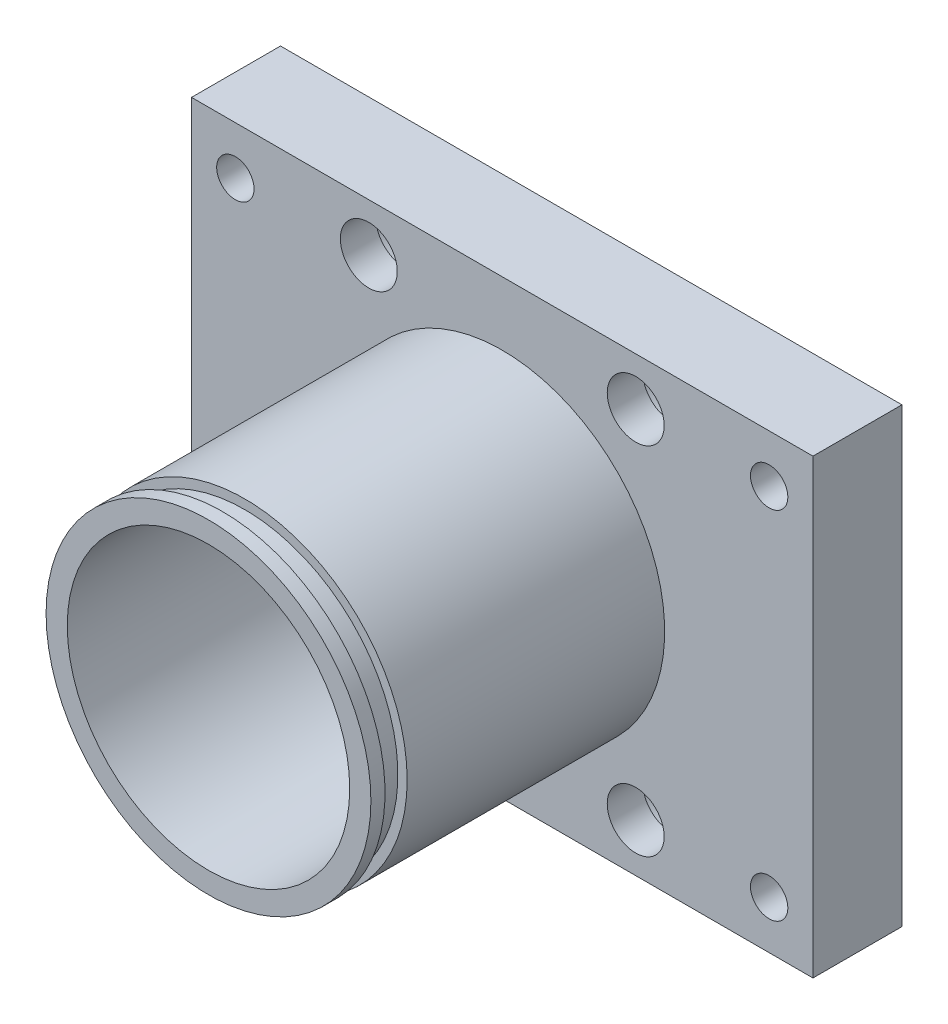
from build123d import *

# Parameters (mm, degrees)
SKETCH1_W                      = 69.85
SKETCH1_H                      = 50.8
BOSS_EXTRUDE1_DEPTH            = 10
SKETCH2_R                      = 15.875
CUT_EXTRUDE1_DEPTH             = 45.327368803
M5X0_8_TAPPED_HOLE1_D          = 4.2
CBORE_FOR_M6_SHCS1_D           = 6.4
CBORE_FOR_M6_SHCS1_CBORE_D     = 10.1
CBORE_FOR_M6_SHCS1_CBORE_DEPTH = 6
MIRROR2_COPY_1_D               = 4.2
MIRROR2_COPY_2_D               = 6.4
MIRROR2_COPY_2_CBORE_D         = 10.1
MIRROR2_COPY_2_CBORE_DEPTH     = 6
MIRROR2_COPY_3_D               = 4.2
MIRROR2_COPY_4_D               = 6.4
MIRROR2_COPY_4_CBORE_D         = 10.1
MIRROR2_COPY_4_CBORE_DEPTH     = 6
BOSS_EXTRUDE2_START            = 33.02
SKETCH7_R                      = 18.25625
SKETCH7_R_2                    = 15.875
BOSS_EXTRUDE2_DEPTH            = 33.02
SKETCH8_R                      = 18.85315
SKETCH8_R_2                    = 16.66875
CUT_EXTRUDE2_DEPTH             = 1.3208
SKETCH9_W                      = 2.4892
SKETCH9_H                      = 1.2954


with BuildPart() as part:
    # Sketch1 → Boss-Extrude1 (new body)
    with BuildSketch(Plane.XY):
        Rectangle(SKETCH1_W, SKETCH1_H)
    extrude(amount=BOSS_EXTRUDE1_DEPTH)

    # Sketch2 → Cut-Extrude1 (cut, through all)
    with BuildSketch(Plane.XY.offset(10)):
        Circle(SKETCH2_R)
    extrude(amount=-CUT_EXTRUDE1_DEPTH, mode=Mode.SUBTRACT)

    # M5x0.8 Tapped Hole1 (through all)
    with Locations(Plane.XY.offset(10)):
        with Locations((30, 19.999999878)):
            m5x0_8_tapped_hole1 = Hole(M5X0_8_TAPPED_HOLE1_D / 2)

    # CBORE for M6 SHCS1 (through all)
    with Locations(Plane(origin=(0, 0, 0), x_dir=(-1, 0, 0), z_dir=(0, 0, -1))):
        with Locations((-15, 20)):
            cbore_for_m6_shcs1 = CounterBoreHole(CBORE_FOR_M6_SHCS1_D / 2, CBORE_FOR_M6_SHCS1_CBORE_D / 2, CBORE_FOR_M6_SHCS1_CBORE_DEPTH)

    # Mirror1: M5x0.8 Tapped Hole1, CBORE for M6 SHCS1 across plane
    add(m5x0_8_tapped_hole1.mirror(Plane.ZX), mode=Mode.SUBTRACT)
    add(cbore_for_m6_shcs1.mirror(Plane.ZX), mode=Mode.SUBTRACT)

    # Mirror2 copy 1 (through all)
    with Locations(Plane(origin=(0, 0, 10), x_dir=(-1, 0, 0), z_dir=(0, 0, 1))):
        with Locations((30, 19.999999878)):
            Hole(MIRROR2_COPY_1_D / 2)

    # Mirror2 copy 2 (through all)
    with Locations(Plane(origin=(0, 0, 0), x_dir=(1, 0, 0), z_dir=(0, 0, -1))):
        with Locations((-15, 20)):
            CounterBoreHole(MIRROR2_COPY_2_D / 2, MIRROR2_COPY_2_CBORE_D / 2, MIRROR2_COPY_2_CBORE_DEPTH)

    # Mirror2 copy 3 (through all)
    with Locations(Plane(origin=(0, 0, 10), x_dir=(-1, 0, 0), z_dir=(0, 0, 1))):
        with Locations((30, -19.999999878)):
            Hole(MIRROR2_COPY_3_D / 2)

    # Mirror2 copy 4 (through all)
    with Locations(Plane(origin=(0, 0, 0), x_dir=(1, 0, 0), z_dir=(0, 0, -1))):
        with Locations((-15, -20)):
            CounterBoreHole(MIRROR2_COPY_4_D / 2, MIRROR2_COPY_4_CBORE_D / 2, MIRROR2_COPY_4_CBORE_DEPTH)

    # Sketch7 → Boss-Extrude2 (add)
    with BuildSketch(Plane.XY.offset(10).offset(BOSS_EXTRUDE2_START)):
        Circle(SKETCH7_R)
        Circle(SKETCH7_R_2, mode=Mode.SUBTRACT)
    extrude(amount=-BOSS_EXTRUDE2_DEPTH)

    # Sketch8 → Cut-Extrude2 (cut)
    with BuildSketch(Plane(origin=(0, 0, 0), x_dir=(-1, 0, 0), z_dir=(0, 0, -1))):
        Circle(SKETCH8_R)
        Circle(SKETCH8_R_2, mode=Mode.SUBTRACT)
    extrude(amount=-CUT_EXTRUDE2_DEPTH, mode=Mode.SUBTRACT)

    # Sketch9 → Cut-Revolve1 (revolve, cut)
    with BuildSketch(Plane(origin=(0, 0, 0), x_dir=(0, 0, -1), z_dir=(1, 0, 0))):
        with Locations((-40.1879, -17.85874)):
            Rectangle(SKETCH9_W, SKETCH9_H)
    revolve(axis=Axis((0, 0, -4.391211434), (0, 0, 1)), mode=Mode.SUBTRACT)


solid = part.part
